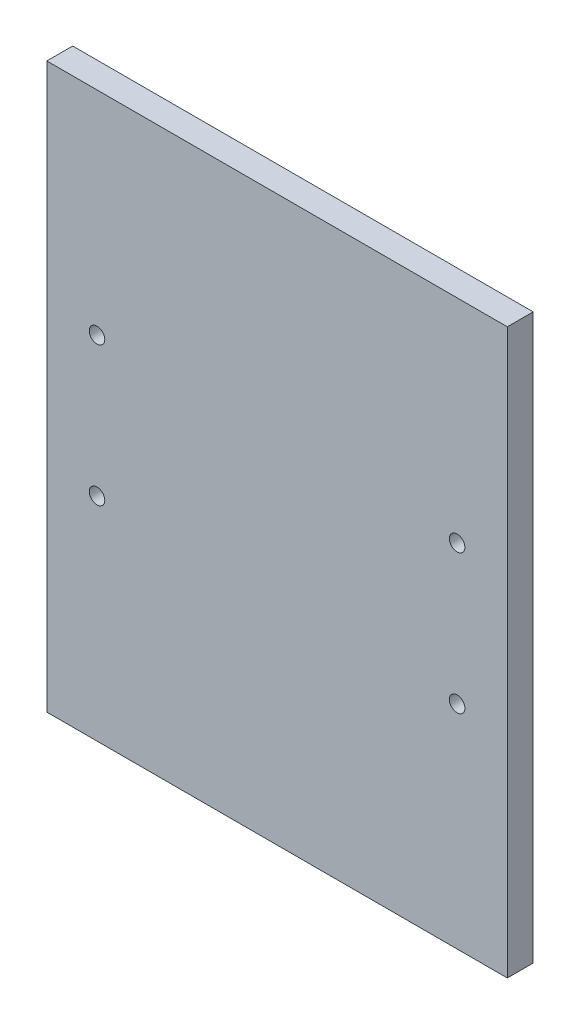
from build123d import *

# Parameters (mm, degrees)
SKETCH1_W           = 89
SKETCH1_H           = 109
BOSS_EXTRUDE1_DEPTH = 5
SKETCH2_R           = 1.5
CUT_EXTRUDE1_DEPTH  = 5


with BuildPart() as part:
    # Sketch1 → Boss-Extrude1 (new body)
    with BuildSketch(Plane.XY):
        Rectangle(SKETCH1_W, SKETCH1_H)
    extrude(amount=BOSS_EXTRUDE1_DEPTH)

    # Sketch2 → Cut-Extrude1 (cut)
    with BuildSketch(Plane.XY.offset(5)):
        with Locations((-34.8, 13.46)):
            Circle(SKETCH2_R)
        with Locations((34.8, 13.46)):
            Circle(SKETCH2_R)
        with Locations((34.8, -13.46)):
            Circle(SKETCH2_R)
        with Locations((-34.8, -13.46)):
            Circle(SKETCH2_R)
    extrude(amount=-CUT_EXTRUDE1_DEPTH, mode=Mode.SUBTRACT)


solid = part.part
